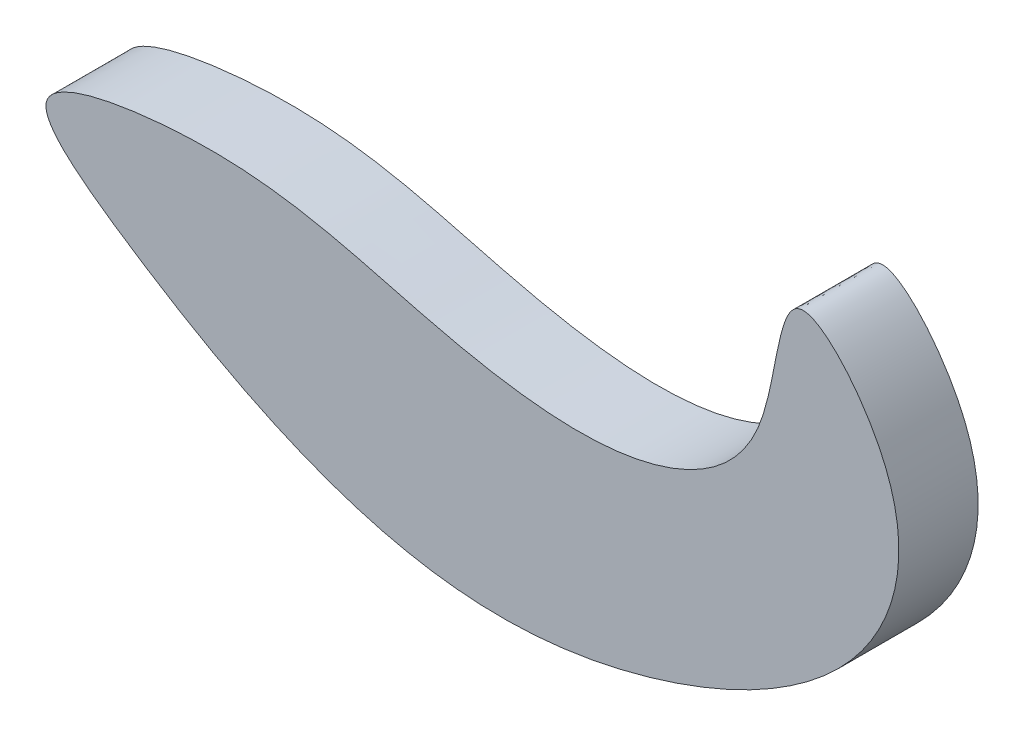
from build123d import *

# Parameters (mm, degrees)
BOSS_EXTRUDE1_DEPTH = 10
SCALE1_DEPTH        = 10
SCALE1_2_DEPTH      = 2.917222417
SCALE1_START        = 7.083222417
SCALE1_3_DEPTH      = 2.916777583
SCALE1_START_2      = 2.917222417
SCALE1_4_DEPTH      = 4.166


# Read off the part's stored shape, not the designer's step: Scale1
with BuildPart() as part:
    # Sketch2 → Boss-Extrude1 (new body)
    with BuildSketch(Plane.XY):
        with BuildLine():
            add(Edge.make_bspline(
                [(10, 5), (10.535044764, 8.001043852), (35.873600322, 12.761777341), (56.214894366, 4.642935142), (86.292094636, 0.401715564), (102.23594678, 13.212319528), (102.127853029, 36.796050656), (119.220081387, 17.494120657), (116.686807893, -6.725132798), (73.268639145, -28.681122449), (40.149881228, -20.026970488), (9.521441415, 2.315784778), (10, 5)],
                knots=[0, 0, 0, 0, 0.060310056, 0.195167442, 0.309597728, 0.363540683, 0.423850739, 0.477793693, 0.554080551, 0.691608639, 0.946057046, 1, 1, 1, 1], degree=3))
        make_face()
    extrude(amount=BOSS_EXTRUDE1_DEPTH)

    # Scale1 outline → Scale1 (cut)
    with BuildSketch(Plane.XY):
        with BuildLine():
            add(Edge.make_bspline(
                [(89.128099835, 4.649321165), (89.628896752, 2.440269589), (88.253799103, -4.572136669), (70.910364109, -13.342480748), (57.113089561, -9.737161041), (41.857930371, 1.391133132), (55.331590936, 3.922631304), (63.805774035, 0.540321644), (75.522835198, -1.111914228), (80.055121404, 1.851478929), (80.87696462, 2.837537466)],
                knots=[0, 0, 0, 0, 0.057011283, 0.194539371, 0.448987778, 0.502930732, 0.563240788, 0.698098174, 0.812528461, 0.846794337, 0.846794337, 0.846794337, 0.846794337], degree=3))
            add(Edge.make_bspline(
                [(80.87696462, 2.837537466), (73.960289952, 2.22916063), (53.844834166, 5.588899776), (35.873600322, 12.761777341), (3.531640253, 6.685209478), (40.149881228, -20.026970488), (73.268639145, -28.681122449), (116.686807893, -6.725132798), (119.220081387, 17.494120657), (102.127853029, 36.796050656), (102.23594678, 13.212319528), (94.016236524, 6.607927325), (89.420968411, 4.76080057), (89.128099835, 4.649321165)],
                knots=[0.726474965, 0.726474965, 0.726474965, 0.726474965, 0.804832558, 0.939689944, 1, 1.053942954, 1.308391361, 1.445919449, 1.522206307, 1.576149261, 1.636459317, 1.690402272, 1.694044888, 1.694044888, 1.694044888, 1.694044888], degree=3))
        make_face()
    extrude(amount=SCALE1_DEPTH, mode=Mode.SUBTRACT)

    # Scale1 2 outline → Scale1 2 (cut)
    with BuildSketch(Plane.XY):
        with BuildLine():
            add(Edge.make_bspline(
                [(80.87696462, 2.837537466), (80.055121404, 1.851478929), (75.522835198, -1.111914228), (63.805774035, 0.540321644), (55.331590936, 3.922631304), (41.857930371, 1.391133132), (57.113089561, -9.737161041), (70.910364109, -13.342480748), (88.253799103, -4.572136669), (89.628896752, 2.440269589), (89.128099835, 4.649321165)],
                knots=[0.656136395, 0.656136395, 0.656136395, 0.656136395, 0.690402272, 0.804832558, 0.939689944, 1, 1.053942954, 1.308391361, 1.445919449, 1.502930732, 1.502930732, 1.502930732, 1.502930732], degree=3))
            add(Edge.make_bspline(
                [(89.128099835, 4.649321165), (86.520701638, 3.656824274), (83.739588157, 3.089328087), (80.87696462, 2.837537466)],
                knots=[0.694044888, 0.694044888, 0.694044888, 0.694044888, 0.726474965, 0.726474965, 0.726474965, 0.726474965], degree=3))
        make_face()
    extrude(amount=SCALE1_2_DEPTH, mode=Mode.SUBTRACT)

    # Scale1 3 outline → Scale1 3 (cut)
    with BuildSketch(Plane.XY.offset(SCALE1_START)):
        with BuildLine():
            add(Edge.make_bspline(
                [(80.87696462, 2.837537466), (80.055121404, 1.851478929), (75.522835198, -1.111914228), (63.805774035, 0.540321644), (55.331590936, 3.922631304), (41.857930371, 1.391133132), (57.113089561, -9.737161041), (70.910364109, -13.342480748), (88.253799103, -4.572136669), (89.628896752, 2.440269589), (89.128099835, 4.649321165)],
                knots=[0.656136395, 0.656136395, 0.656136395, 0.656136395, 0.690402272, 0.804832558, 0.939689944, 1, 1.053942954, 1.308391361, 1.445919449, 1.502930732, 1.502930732, 1.502930732, 1.502930732], degree=3))
            add(Edge.make_bspline(
                [(89.128099835, 4.649321165), (86.520701638, 3.656824274), (83.739588157, 3.089328087), (80.87696462, 2.837537466)],
                knots=[0.694044888, 0.694044888, 0.694044888, 0.694044888, 0.726474965, 0.726474965, 0.726474965, 0.726474965], degree=3))
        make_face()
    extrude(amount=SCALE1_3_DEPTH, mode=Mode.SUBTRACT)

    # Scale1 4 outline → Scale1 4 (add)
    with BuildSketch(Plane.XY.offset(SCALE1_START_2)):
        with BuildLine():
            add(Edge.make_bspline(
                [(89.128099827, 4.649321179), (86.520701638, 3.656824274), (83.739588157, 3.089328087), (80.876964622, 2.837537462)],
                knots=[0.694044888, 0.694044888, 0.694044888, 0.694044888, 0.726474965, 0.726474965, 0.726474965, 0.726474965], degree=3))
            add(Edge.make_bspline(
                [(89.128099827, 4.649321179), (88.958779873, 5.396203817), (87.923179179, 8.300121836), (82.933112614, 13.935309567), (82.968970314, 6.111930687), (81.348905644, 3.40377865), (80.876964622, 2.837537462)],
                knots=[0.502930732, 0.502930732, 0.502930732, 0.502930732, 0.522206307, 0.576149261, 0.636459317, 0.656136395, 0.656136395, 0.656136395, 0.656136395], degree=3))
        make_face()
    extrude(amount=SCALE1_4_DEPTH)


solid = part.part
